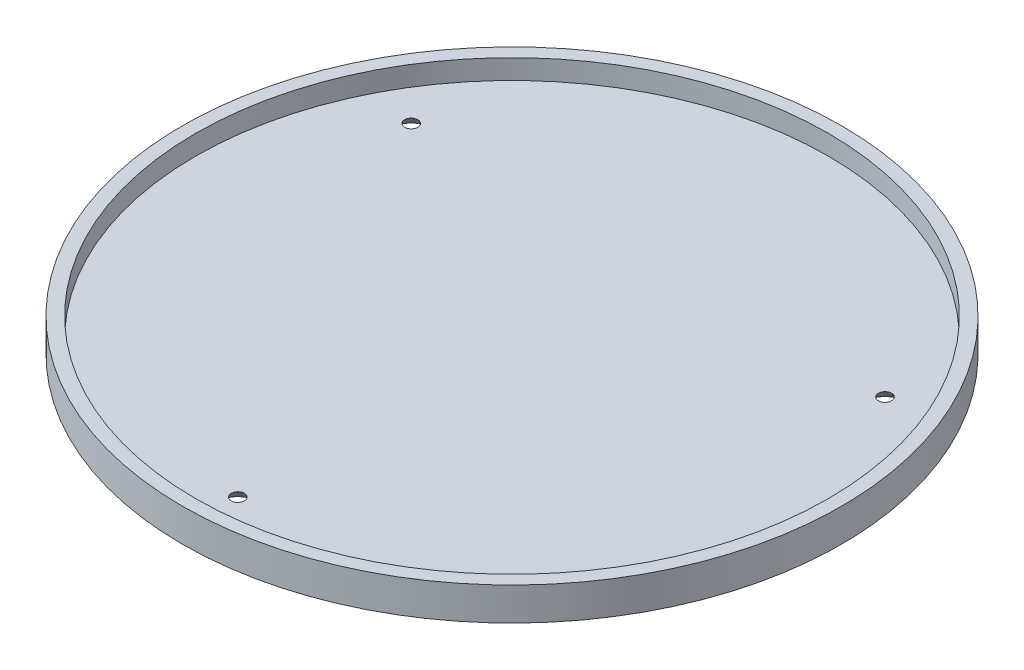
from build123d import *

# Parameters (mm, degrees)
SKETCH_1_R          = 50
EXTRUDE_1_DEPTH     = 2
SKETCH_2_R          = 50
SKETCH_2_R_2        = 48
EXTRUDE_2_DEPTH     = 3
SKETCH_3_R          = 1
CUT_EXTRUDE_1_DEPTH = 20
FILLET_1_SIZE       = 2


with BuildPart() as part:
    # 草图1 → 凸台-拉伸1 (new body)
    with BuildSketch(Plane(origin=(0, 0, 0), x_dir=(1, 0, 0), z_dir=(0, 1, 0))):
        with Locations(Location((0, 0, 0), (0, 0, 270))):
            Circle(SKETCH_1_R)
    extrude(amount=EXTRUDE_1_DEPTH)

    # 草图2 → 凸台-拉伸2 (add)
    with BuildSketch(Plane(origin=(0, 2, 0), x_dir=(1, 0, 0), z_dir=(0, 1, 0))):
        with Locations(Location((0, 0, 0), (0, 0, 270))):
            Circle(SKETCH_2_R)
        with Locations(Location((0, 0, 0), (0, 0, 270))):
            Circle(SKETCH_2_R_2, mode=Mode.SUBTRACT)
    extrude(amount=EXTRUDE_2_DEPTH)

    # 草图3 → 切除-拉伸1 (cut)
    with BuildSketch(Plane.XZ):
        with Locations(Location((0, 41.598526054, 0), (0, 0, 270))):
            Circle(SKETCH_3_R)
        with Locations(Location((-35.940054257, -20.651473946, 0), (0, 0, 270))):
            Circle(SKETCH_3_R)
        with Locations(Location((35.940054257, -20.651473946, 0), (0, 0, 270))):
            Circle(SKETCH_3_R)
    extrude(amount=-CUT_EXTRUDE_1_DEPTH, mode=Mode.SUBTRACT)

    # 圆角1
    # a fillet whose section is not a circle: 2 mm, written as the material it takes off along each edge
    with BuildSketch(Plane(origin=(0, 0, 41.598526054), x_dir=(0, 0, -1), z_dir=(-1, 0, 0))) as fillet_1_piece_1:
        with BuildLine():
            Bezier((1 + FILLET_1_SIZE, 0), (1, 0), (1, -FILLET_1_SIZE), weights=[1, 0.141421356, 1])
            Line((1, -FILLET_1_SIZE), (1, 0))
            Line((1, 0), (1 + FILLET_1_SIZE, 0))
        make_face()
    revolve(axis=Axis((0, 0, 41.598526054), (0, -1, 0)), mode=Mode.SUBTRACT)
    with BuildSketch(Plane(origin=(-35.940054257, 0, -20.651473946), x_dir=(0, 0, -1), z_dir=(-1, 0, 0))) as fillet_1_piece_2:
        with BuildLine():
            Bezier((1 + FILLET_1_SIZE, 0), (1, 0), (1, -FILLET_1_SIZE), weights=[1, 0.141421356, 1])
            Line((1, -FILLET_1_SIZE), (1, 0))
            Line((1, 0), (1 + FILLET_1_SIZE, 0))
        make_face()
    revolve(axis=Axis((-35.940054257, 0, -20.651473946), (0, -1, 0)), mode=Mode.SUBTRACT)
    with BuildSketch(Plane(origin=(35.940054257, 0, -20.651473946), x_dir=(0, 0, -1), z_dir=(-1, 0, 0))) as fillet_1_piece_3:
        with BuildLine():
            Bezier((1 + FILLET_1_SIZE, 0), (1, 0), (1, -FILLET_1_SIZE), weights=[1, 0.141421356, 1])
            Line((1, -FILLET_1_SIZE), (1, 0))
            Line((1, 0), (1 + FILLET_1_SIZE, 0))
        make_face()
    revolve(axis=Axis((35.940054257, 0, -20.651473946), (0, -1, 0)), mode=Mode.SUBTRACT)


solid = part.part
